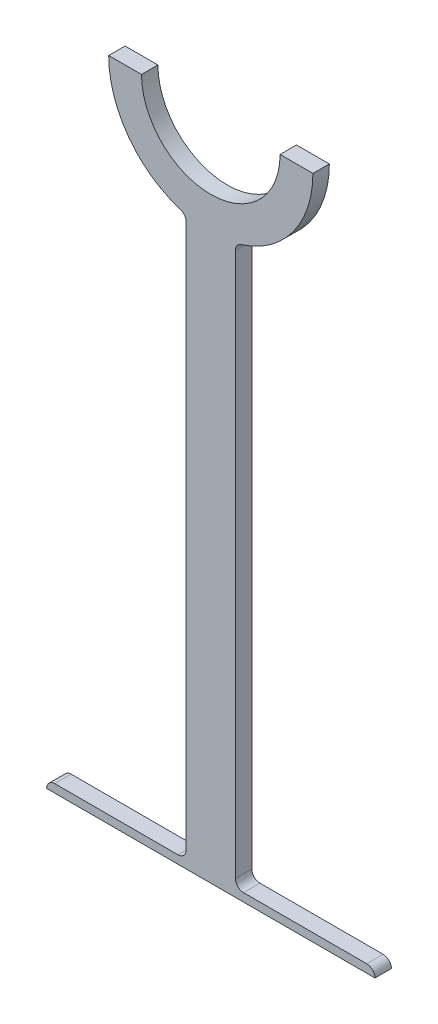
from build123d import *

# Parameters (mm, degrees)
BOSS_EXTRUDE1_DEPTH      = 2.5
SKETCH3_W                = 15
SKETCH3_H                = 175
BOSS_EXTRUDE2_DEPTH      = 2.5
BOSS_EXTRUDE4_DEPTH      = 50
BOSS_EXTRUDE4_DEPTH_BACK = 50
SKETCH5_W                = 5
SKETCH5_H                = 2.5
FILLET1_R                = 2.5
FILLET2_R                = 2.5
FILLET3_R                = 2.5
FILLET4_R                = 2.5
FILLET5_R                = 2.5
FILLET6_R                = 2.5


with BuildPart() as part:
    # Sketch1 → Boss-Extrude1 (new, symmetric)
    with BuildSketch(Plane.XY):
        with BuildLine():
            Line((-21.1, 0), (-31.1, 0))
            ThreePointArc((-31.1, 0), (0, -31.1), (31.1, 0))
            Line((31.1, 0), (21.1, 0))
            ThreePointArc((21.1, 0), (0, -21.1), (-21.1, 0))
        make_face()
    extrude(amount=BOSS_EXTRUDE1_DEPTH, both=True)

    # Sketch3 → Boss-Extrude2 (add, symmetric)
    with BuildSketch(Plane.XY):
        with Locations((0, -115.239187588)):
            Rectangle(SKETCH3_W, SKETCH3_H)
    extrude(amount=BOSS_EXTRUDE2_DEPTH, both=True)

    # Sketch5 → Boss-Extrude4 (add, two sides: drawn at the far end of the back side and taken through both)
    with BuildSketch(Plane(origin=(0, 0, 0), x_dir=(0, 0, -1), z_dir=(1, 0, 0)).offset(-BOSS_EXTRUDE4_DEPTH_BACK)):
        with Locations((0, -201.489187588)):
            Rectangle(SKETCH5_W, SKETCH5_H)
    extrude(amount=BOSS_EXTRUDE4_DEPTH + BOSS_EXTRUDE4_DEPTH_BACK)

    # Fillet1
    fillet1_edges = [part.edges().sort_by_distance(p)[0] for p in [
        (7.5, -200.239187588, 0),
    ]]
    fillet(fillet1_edges, radius=FILLET1_R)

    # Fillet2
    fillet2_edges = [part.edges().sort_by_distance(p)[0] for p in [
        (-7.5, -200.239187588, 0),
    ]]
    fillet(fillet2_edges, radius=FILLET2_R)

    # Fillet3
    fillet3_edges = [part.edges().sort_by_distance(p)[0] for p in [
        (7.5, -30.182113909, 0),
    ]]
    fillet(fillet3_edges, radius=FILLET3_R)

    # Fillet4
    fillet4_edges = [part.edges().sort_by_distance(p)[0] for p in [
        (-7.5, -30.182113909, 0),
    ]]
    fillet(fillet4_edges, radius=FILLET4_R)

    # Fillet5
    fillet5_edges = [part.edges().sort_by_distance(p)[0] for p in [
        (50, -200.239187588, 0),
    ]]
    fillet(fillet5_edges, radius=FILLET5_R - 0.0001)  # a hair under: the kernel refuses the full size

    # Fillet6
    fillet6_edges = [part.edges().sort_by_distance(p)[0] for p in [
        (-50, -200.239187588, 0),
    ]]
    fillet(fillet6_edges, radius=FILLET6_R - 0.0001)  # a hair under: the kernel refuses the full size


solid = part.part
